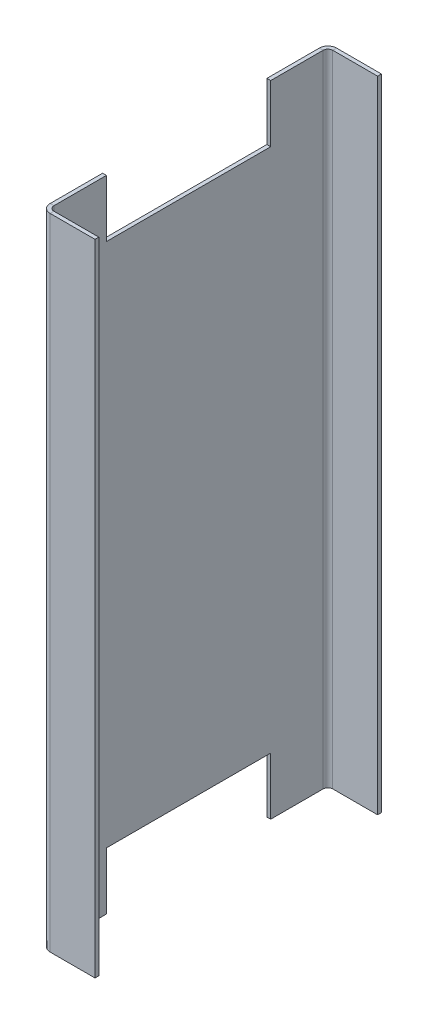
from build123d import *

# Parameters (mm, degrees)
SKETCH1_W                      = 150
SKETCH1_H                      = 335
BASE_FLANGE1_DEPTH             = 2
EDGE_FLANGE1_STRIP_W           = 13
EDGE_FLANGE1_STRIP_H           = 2
EDGE_FLANGE1_STRIP_CUT_DEPTH   = 335
EDGE_FLANGE1_STRIP_2_W         = 13
EDGE_FLANGE1_STRIP_2_H         = 2
EDGE_FLANGE1_STRIP_CUT_2_DEPTH = 335
EDGE_FLANGE1_DEPTH             = 335
EDGE_FLANGE1_BEND_DEPTH        = 335
SKETCH11_W                     = 86
SKETCH11_H                     = 30
CUT_EXTRUDE1_DEPTH             = 10


# Sheet-metal steps are written as plain solids
with BuildPart() as part:
    # Sketch1 → Base-Flange1 (new body)
    with BuildSketch(Plane(origin=(0, 0, 0), x_dir=(0, 0, -1), z_dir=(1, 0, 0))):
        Rectangle(SKETCH1_W, SKETCH1_H)
    extrude(amount=-BASE_FLANGE1_DEPTH)

    # Edge-Flange1 strip (across the edge) → Edge-Flange1 strip cut (cut)
    with BuildSketch(Plane(origin=(0, -167.5, -75), x_dir=(0, 0, 1), z_dir=(0, 1, 0))):
        with Locations((-2, -1)):
            Rectangle(EDGE_FLANGE1_STRIP_W, EDGE_FLANGE1_STRIP_H)
    extrude(amount=EDGE_FLANGE1_STRIP_CUT_DEPTH, mode=Mode.SUBTRACT)

    # Edge-Flange1 strip 2 (across the edge) → Edge-Flange1 strip cut 2 (cut)
    with BuildSketch(Plane(origin=(0, 167.5, 75), x_dir=(0, 0, -1), z_dir=(0, -1, 0))):
        with Locations((-2, -1)):
            Rectangle(EDGE_FLANGE1_STRIP_2_W, EDGE_FLANGE1_STRIP_2_H)
    extrude(amount=EDGE_FLANGE1_STRIP_CUT_2_DEPTH, mode=Mode.SUBTRACT)

    # Edge-Flange1 section (across the edge) → Edge-Flange1 (add)
    with BuildSketch(Plane(origin=(0, -167.5, -75), x_dir=(0, 0, 1), z_dir=(0, 1, 0))):
        with BuildLine():
            Line((0, 2.5), (0, 26))
            Line((0, 26), (2, 26))
            Line((2, 26), (2, 2.5))
            ThreePointArc((2, 2.5), (2.732233047, 0.732233047), (4.5, 0))
            Line((4.5, 0), (4.5, -2))
            ThreePointArc((4.5, -2), (1.318019485, -0.681980515), (0, 2.5))
        make_face()
    extrude(amount=EDGE_FLANGE1_DEPTH)

    # Edge-Flange1 section 2 (across the edge) → Edge-Flange1 bend (add)
    with BuildSketch(Plane(origin=(0, 167.5, 75), x_dir=(0, 0, -1), z_dir=(0, -1, 0))):
        with BuildLine():
            Line((0, 2.5), (0, 26))
            Line((0, 26), (2, 26))
            Line((2, 26), (2, 2.5))
            ThreePointArc((2, 2.5), (2.732233047, 0.732233047), (4.5, 0))
            Line((4.5, 0), (4.5, -2))
            ThreePointArc((4.5, -2), (1.318019485, -0.681980515), (0, 2.5))
        make_face()
    extrude(amount=EDGE_FLANGE1_BEND_DEPTH)

    # Sketch11 → Cut-Extrude1 (cut)
    with BuildSketch(Plane(origin=(0, 0, 0), x_dir=(0, 0, -1), z_dir=(1, 0, 0))):
        with Locations((0, 152.5)):
            Rectangle(SKETCH11_W, SKETCH11_H)
    cut_extrude1 = extrude(amount=-CUT_EXTRUDE1_DEPTH, mode=Mode.SUBTRACT)

    # Mirror1: Cut-Extrude1 across plane
    add(cut_extrude1.mirror(Plane.ZX), mode=Mode.SUBTRACT)


solid = part.part
